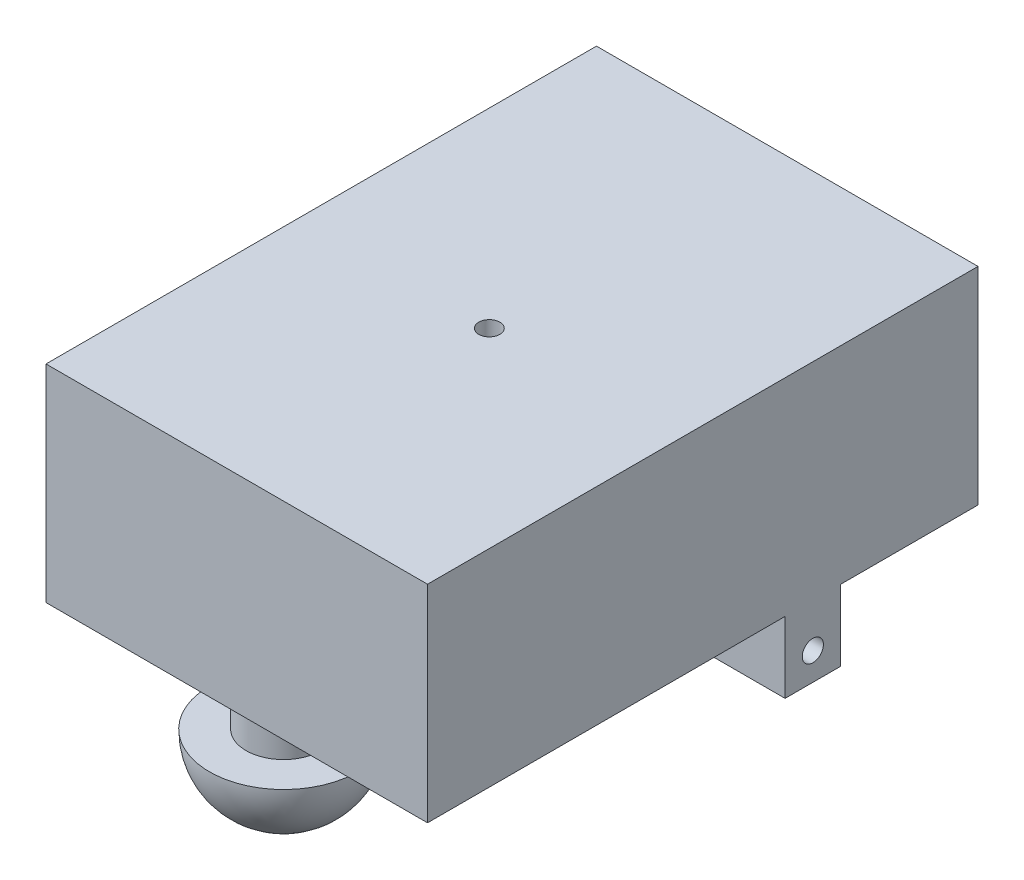
from build123d import *

# Parameters (mm, degrees)
SKETCH2_W           = 180
SKETCH2_H           = 259.71
BOSS_EXTRUDE1_DEPTH = 97.5
SKETCH4_R           = 17.7
BOSS_EXTRUDE2_DEPTH = 17.7
SKETCH5_R           = 35
BOSS_EXTRUDE3_DEPTH = 35
FILLET2_R           = 35
SKETCH8_W           = 180
SKETCH8_H           = 26.2
BOSS_EXTRUDE4_DEPTH = 33.5
SKETCH9_R           = 5
CUT_EXTRUDE1_DEPTH  = 250.575830668
SKETCH10_R          = 5
CUT_EXTRUDE2_DEPTH  = 10


with BuildPart() as part:
    # Sketch2 → Boss-Extrude1 (new body)
    with BuildSketch(Plane(origin=(0, 0, 0), x_dir=(1, 0, 0), z_dir=(0, 1, 0))):
        Rectangle(SKETCH2_W, SKETCH2_H)
    extrude(amount=BOSS_EXTRUDE1_DEPTH)

    # Sketch4 → Boss-Extrude2 (add)
    with BuildSketch(Plane.XZ):
        with Locations(Location((0, 107.765, 0), (0, 0, 270))):
            Circle(SKETCH4_R)
    extrude(amount=BOSS_EXTRUDE2_DEPTH)

    # Sketch5 → Boss-Extrude3 (add)
    with BuildSketch(Plane.XZ.offset(17.7)):
        with Locations(Location((0, 107.765, 0), (0, 0, 270))):
            Circle(SKETCH5_R)
    extrude(amount=BOSS_EXTRUDE3_DEPTH)

    # Fillet2
    fillet2_edges = [part.edges().sort_by_distance(p)[0] for p in [
        (0, -52.7, 142.765),
    ]]
    fillet(fillet2_edges, radius=FILLET2_R - 0.0001)  # a hair under: the kernel refuses the full size

    # Sketch8 → Boss-Extrude4 (add)
    with BuildSketch(Plane.XZ):
        with Locations((0, -51.935)):
            Rectangle(SKETCH8_W, SKETCH8_H)
    extrude(amount=BOSS_EXTRUDE4_DEPTH)

    # Sketch9 → Cut-Extrude1 (cut, through all)
    with BuildSketch(Plane(origin=(90, 0, 0), x_dir=(0, 0, -1), z_dir=(1, 0, 0))):
        with Locations((51.935, -20.5)):
            Circle(SKETCH9_R)
    extrude(amount=-CUT_EXTRUDE1_DEPTH, mode=Mode.SUBTRACT)

    # Sketch10 → Cut-Extrude2 (cut)
    with BuildSketch(Plane(origin=(0, 97.5, 0), x_dir=(1, 0, 0), z_dir=(0, 1, 0))):
        with Locations(Location((0, -10.705, 0), (0, 0, 270))):
            Circle(SKETCH10_R)
    extrude(amount=-CUT_EXTRUDE2_DEPTH, mode=Mode.SUBTRACT)


solid = part.part
